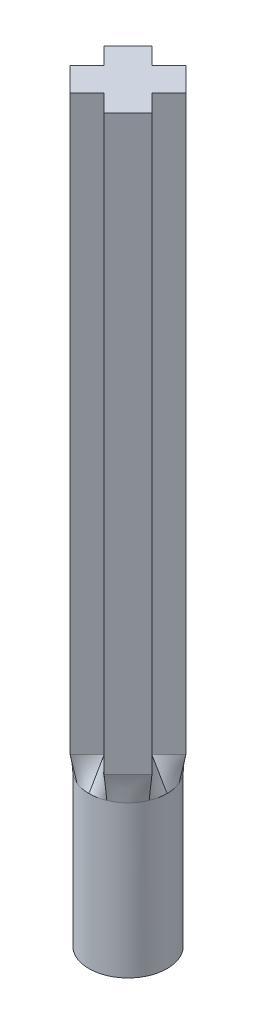
from build123d import *

# Parameters (mm, degrees)
BOSS_EXTRUDE1_DEPTH = 60.739130435
SCALE1_SCALE        = 0.92
SKETCH4_R           = 3.81
SKETCH3_R           = 3.81
BOSS_EXTRUDE2_DEPTH = 14.7955


with BuildPart() as part:
    # Sketch1 → Boss-Extrude1 (new body)
    with BuildSketch(Plane(origin=(0, 0, 0), x_dir=(1, 0, 0), z_dir=(0, 1, 0))):
        Polygon((-0.6269783, 2.91618698), (-2.423029524, 4.712238204), (-4.963029524, 2.172238204), (-3.1669783, 0.37618698), (-4.963029524, -1.419864244), (-2.423029524, -3.959864244), (-0.6269783, -2.16381302), (1.169072924, -3.959864244), (3.709072924, -1.419864244), (1.9130217, 0.37618698), (3.709072924, 2.172238204), (1.169072924, 4.712238204), align=None)
    extrude(amount=BOSS_EXTRUDE1_DEPTH)


with BuildPart() as part_1:
    # Scale1: scaled about (-0.6269783, 30.369565217, -0.37618698)
    add(part.part.scale(SCALE1_SCALE).moved(Location((-0.050158264, 2.429565217, -0.030094958))))

    # Sketch4 → section 1 of loft1
    with BuildSketch(Plane(origin=(0, -0.110434783, 0), x_dir=(-1, 0, 0), z_dir=(0, -1, 0)), mode=Mode.PRIVATE) as loft1_s1:
        with Locations((0.6269783, 0.37618698)):
            Circle(SKETCH4_R)
    # loft from a face of the part (loft1)
    loft([part_1.faces().sort_by_distance((-0.6269783, 2.429565217, -0.37618698))[0], loft1_s1.sketch])

    # Sketch3 → Boss-Extrude2 (add)
    with BuildSketch(Plane(origin=(0, -0.110434783, 0), x_dir=(1, 0, 0), z_dir=(0, 1, 0))):
        with Locations((-0.6269783, 0.37618698)):
            Circle(SKETCH3_R)
    extrude(amount=-BOSS_EXTRUDE2_DEPTH)


solid = part_1.part
